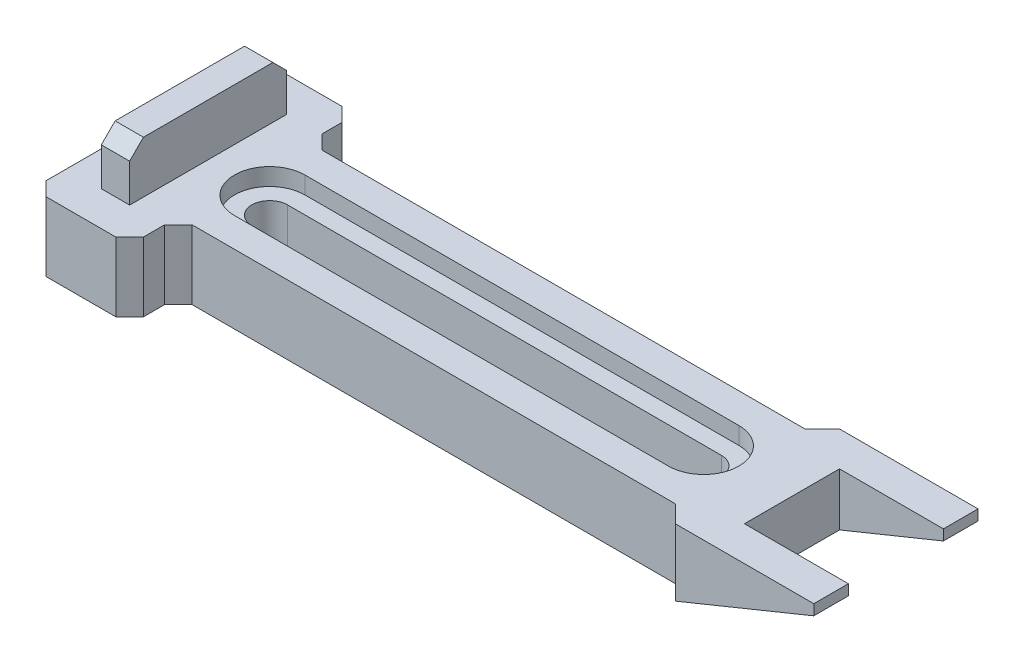
from build123d import *

# Parameters (mm, degrees)
BOSS_EXTRUDE1_DEPTH = 20
CUT_EXTRUDE1_DEPTH  = 5
CUT_EXTRUDE2_DEPTH  = 132.297386022
CHAMFER1_SIZE       = 4
BOSS_EXTRUDE2_DEPTH = 15
CHAMFER2_SIZE       = 4
BOSS_EXTRUDE3_DEPTH = 20
CHAMFER3_SIZE       = 5
CUT_EXTRUDE3_DEPTH  = 60
SCALE2_SCALE        = 0.19


with BuildPart() as part:
    # Sketch1 → Boss-Extrude1 (new body)
    with BuildSketch(Plane(origin=(0, 0, 0), x_dir=(1, 0, 0), z_dir=(0, 1, 0))):
        Polygon((-26.074130493, -28.215811716), (-26.074130493, -42.310360901), (-54.263228862, -42.310360901), (-54.263228862, 23.128617456), (-26.074130493, 23.128617456), (-26.074130493, 9.28575665), (122.67370108, 9.28575665), (122.67370108, -28.215811716), align=None)
    extrude(amount=BOSS_EXTRUDE1_DEPTH)

    # Sketch2 → Cut-Extrude1 (cut)
    with BuildSketch(Plane(origin=(0, 20, 0), x_dir=(1, 0, 0), z_dir=(0, 1, 0))):
        with BuildLine():
            Line((-18.280512059, 0.584936596), (107.256828457, 0.584936596))
            ThreePointArc((107.256828457, 0.584936596), (117.432636776, -9.590871723), (107.256828457, -19.766680041))
            Line((107.256828457, -19.766680041), (-18.280512059, -19.766680041))
            ThreePointArc((-18.280512059, -19.766680041), (-28.456320377, -9.590871723), (-18.280512059, 0.584936596))
        make_face()
        with BuildLine():
            Line((-18.280512059, -4.415063404), (107.256828457, -4.415063404))
            ThreePointArc((107.256828457, -4.415063404), (112.432636776, -9.590871723), (107.256828457, -14.766680041))
            Line((107.256828457, -14.766680041), (-18.280512059, -14.766680041))
            ThreePointArc((-18.280512059, -14.766680041), (-23.456320377, -9.590871723), (-18.280512059, -4.415063404))
        make_face(mode=Mode.SUBTRACT)
    extrude(amount=-CUT_EXTRUDE1_DEPTH, mode=Mode.SUBTRACT)

    # Sketch3 → Cut-Extrude2 (cut, through all)
    with BuildSketch(Plane(origin=(0, 20, 0), x_dir=(1, 0, 0), z_dir=(0, 1, 0))):
        with BuildLine():
            Line((-18.280512059, -14.766680041), (107.256828457, -14.766680041))
            ThreePointArc((107.256828457, -14.766680041), (112.432636776, -9.590871723), (107.256828457, -4.415063404))
            Line((107.256828457, -4.415063404), (-18.280512059, -4.415063404))
            ThreePointArc((-18.280512059, -4.415063404), (-23.456320377, -9.590871723), (-18.280512059, -14.766680041))
        make_face()
    extrude(amount=-CUT_EXTRUDE2_DEPTH, mode=Mode.SUBTRACT)

    # Chamfer1
    chamfer1_edges = [part.edges().sort_by_distance(p)[0] for p in [
        (-26.074130493, 10, 28.215811716),
        (-26.074130493, 10, -9.28575665),
        (-26.074130493, 10, -23.128617456),
        (-54.263228862, 10, -23.128617456),
        (-54.263228862, 10, 42.310360901),
        (-26.074130493, 10, 42.310360901),
    ]]
    chamfer(chamfer1_edges, length=CHAMFER1_SIZE)

    # Sketch4 → Boss-Extrude2 (add)
    with BuildSketch(Plane(origin=(0, 20, 0), x_dir=(1, 0, 0), z_dir=(0, 1, 0))):
        Polygon((-36.074130493, -32.215811716), (-36.074130493, 13.128617456), (-44.263228862, 13.128617456), (-44.263228862, -32.310360901), (-36.074130493, -32.310360901), align=None)
    extrude(amount=BOSS_EXTRUDE2_DEPTH)

    # Chamfer2
    chamfer2_edges = [part.edges().sort_by_distance(p)[0] for p in [
        (-40.168679677, 35, -13.128617456),
        (-40.168679677, 35, 32.310360901),
    ]]
    chamfer(chamfer2_edges, length=CHAMFER2_SIZE)

    # Sketch5 → Boss-Extrude3 (add)
    with BuildSketch(Plane(origin=(0, 20, 0), x_dir=(1, 0, 0), z_dir=(0, 1, 0))):
        Polygon((122.67370108, -33.215811716), (162.735602204, -33.215811716), (162.735602204, -23.215811716), (132.67370108, -23.215811716), (132.67370108, 4.28575665), (162.735602204, 4.28575665), (162.735602204, 14.28575665), (122.67370108, 14.28575665), align=None)
    extrude(amount=-BOSS_EXTRUDE3_DEPTH)

    # Chamfer3
    chamfer3_edges = [part.edges().sort_by_distance(p)[0] for p in [
        (122.67370108, 10, -9.28575665),
        (122.67370108, 10, 28.215811716),
    ]]
    chamfer(chamfer3_edges, length=CHAMFER3_SIZE - 0.0001)  # a hair under: the kernel refuses the full size

    # Sketch6 → Cut-Extrude3 (cut)
    with BuildSketch(Plane.XY.offset(33.215811716)):
        Polygon((120.800441338, -0.153311602), (162.735602204, 16.953910153), (162.735602204, 0), align=None)
    extrude(amount=-CUT_EXTRUDE3_DEPTH, mode=Mode.SUBTRACT)


with BuildPart() as part_1:
    # Scale2: scaled about (30.500255958, 10.567938769, 9.471238373)
    add(part.part.scale(SCALE2_SCALE).moved(Location((24.705207326, 8.560030403, 7.671703082))))


solid = part_1.part
